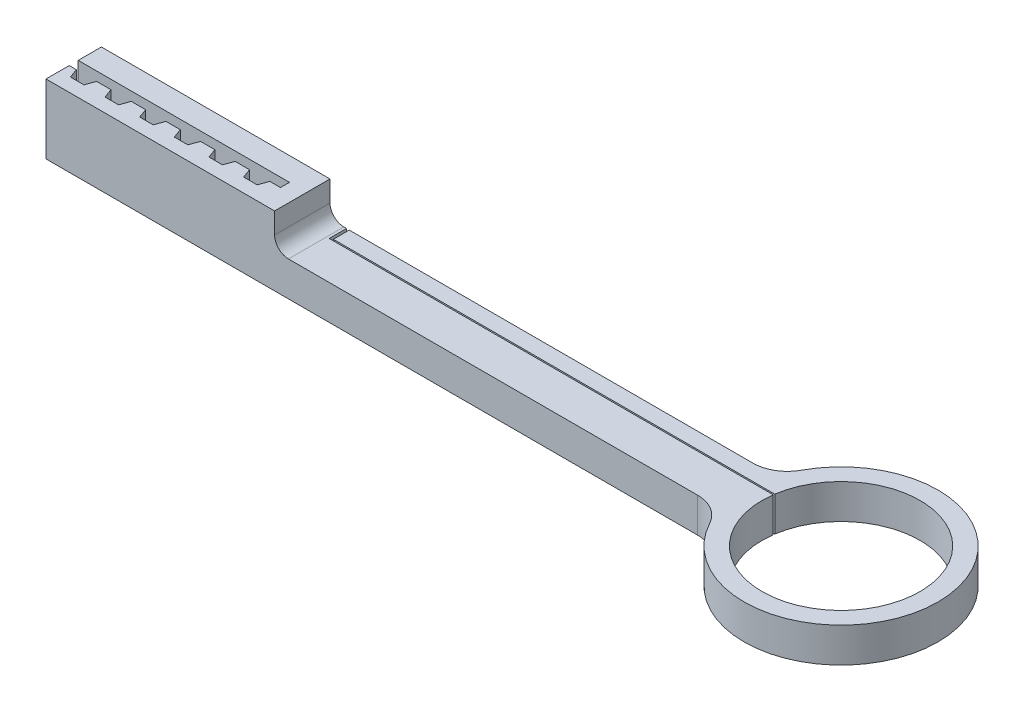
from build123d import *

# Parameters (mm, degrees)
SKETCH_1_R          = 14
SKETCH_1_R_2        = 11.4
RING_DEPTH          = 5
STICK_DEPTH         = 5
SKETCH_3_W          = 33
SKETCH_3_H          = 8
KEY_DEPTH           = 10
FILLET_1_R          = 5
FILLET_5_R          = 2
KEY_HOLE_DEPTH      = 112.914636511
KEY_HOLE_DEPTH_BACK = 112.914636511
CUT_EXTRUDE_2_DEPTH = 113.109927595


with BuildPart() as part:
    # Эскиз1 → ring (new body)
    with BuildSketch(Plane(origin=(0, 0, 0), x_dir=(1, 0, 0), z_dir=(0, 1, 0))):
        Circle(SKETCH_1_R)
        Circle(SKETCH_1_R_2, mode=Mode.SUBTRACT)
    extrude(amount=RING_DEPTH)

    # Эскиз2 → stick (add)
    with BuildSketch(Plane(origin=(0, 0, 0), x_dir=(1, 0, 0), z_dir=(0, 1, 0))):
        with BuildLine():
            Line((-10.781929326, 4), (-110.781929326, 4))
            Line((-110.781929326, 4), (-110.781929326, -4))
            Line((-110.781929326, -4), (-10.781929326, -4))
            ThreePointArc((-10.781929326, -4), (-11.5, 0), (-10.781929326, 4))
        make_face()
    extrude(amount=STICK_DEPTH)

    # Эскиз3 → key (add)
    with BuildSketch(Plane(origin=(0, 0, 0), x_dir=(1, 0, 0), z_dir=(0, 1, 0))):
        with Locations((-94.281929326, 0)):
            Rectangle(SKETCH_3_W, SKETCH_3_H)
    extrude(amount=KEY_DEPTH)

    # Скругление1
    fillet_1_edges = [part.edges().sort_by_distance(p)[0] for p in [
        (-13.416407865, 2.5, 4),
        (-13.416407865, 2.5, -4),
    ]]
    fillet(fillet_1_edges, radius=FILLET_1_R)

    # Скругление5
    fillet_5_edges = [part.edges().sort_by_distance(p)[0] for p in [
        (-77.781929326, 5, 0),
    ]]
    fillet(fillet_5_edges, radius=FILLET_5_R)

    # Эскиз4 → key hole (cut, two sides: drawn at the far end of the back side and taken through both)
    with BuildSketch(Plane(origin=(0, 2.5, 0), x_dir=(1, 0, 0), z_dir=(0, 1, 0)).offset(-KEY_HOLE_DEPTH_BACK)):
        Polygon((-110.781929326, 0.65), (-80.281929326, 0.65), (-80.281929326, -0.65), (-80.781929326, -0.65), (-81.81556951, -0.65), (-82.306929326, -2), (-84.256929326, -2), (-84.748289143, -0.65), (-85.781929326, -0.65), (-86.81556951, -0.65), (-87.306929326, -2), (-89.256929326, -2), (-89.748289143, -0.65), (-90.781929326, -0.65), (-91.81556951, -0.65), (-92.306929326, -2), (-94.256929326, -2), (-94.748289143, -0.65), (-95.781929326, -0.65), (-96.81556951, -0.65), (-97.306929326, -2), (-99.256929326, -2), (-99.748289143, -0.65), (-100.781929326, -0.65), (-101.81556951, -0.65), (-102.306929326, -2), (-104.256929326, -2), (-104.748289143, -0.65), (-105.781929326, -0.65), (-106.81556951, -0.65), (-107.306929326, -2), (-109.256929326, -2), (-109.748289143, -0.65), (-110.781929326, -0.65), align=None)
    extrude(amount=KEY_HOLE_DEPTH + KEY_HOLE_DEPTH_BACK, mode=Mode.SUBTRACT)

    # Эскиз5 → Вытянуть2 (cut, through all)
    with BuildSketch(Plane.XZ):
        Polygon((-75.4, -4), (-75.4, -1.5), (0, -1.5), (0, -1.7), (-75, -1.7), (-75, -4), align=None)
    extrude(amount=-CUT_EXTRUDE_2_DEPTH, mode=Mode.SUBTRACT)


solid = part.part
